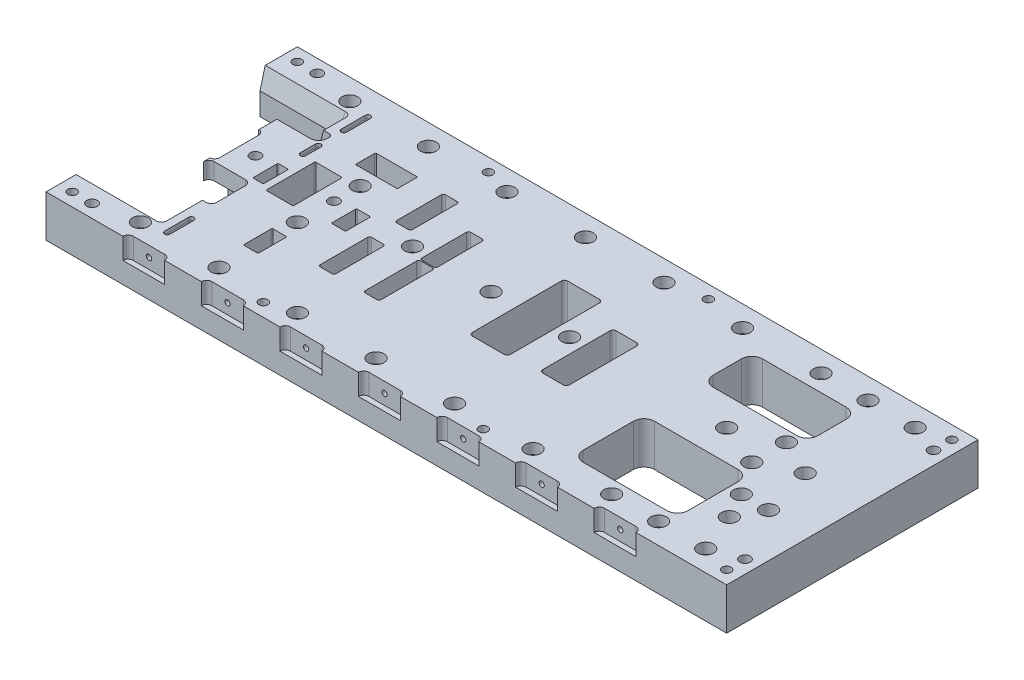
from build123d import *

# Parameters (mm, degrees)
SKETCH1_W                    = 650
SKETCH1_H                    = 240
BOSS_EXTRUDE1_DEPTH          = 40
CUT_EXTRUDE2_REACH           = 350.748
SKETCH3_R                    = 7.500000000000012
SKETCH3_R_2                  = 7.5000000000000115
SKETCH4_R                    = 9.000000000000009
SKETCH4_R_2                  = 8.999999999999984
SKETCH4_R_3                  = 8.999999999999986
CUT_EXTRUDE3_DEPTH           = 5
SKETCH11_R                   = 7.5
SKETCH11_R_2                 = 7.499999999999999
SKETCH11_R_3                 = 7.500000000000012
CUT_EXTRUDE9_DEPTH           = 643.2101968203245
SKETCH12_R                   = 10.000000000000002
CUT_EXTRUDE10_DEPTH          = 5
SKETCH13_R                   = 9.999999999999995
SKETCH13_R_2                 = 9.99999999999998
SKETCH13_R_3                 = 9.999999999999979
CUT_EXTRUDE11_DEPTH          = 30
CUT_EXTRUDE12_REACH          = 350.748
SKETCH28_R                   = 7.500000000000014
SKETCH28_R_2                 = 7.5000000000000275
SKETCH28_R_3                 = 7.499999999999957
SKETCH29_R                   = 8.99999999999998
SKETCH29_R_2                 = 9.00000000000001
SKETCH29_R_3                 = 8.999999999999986
SKETCH29_R_4                 = 8.999999999999968
SKETCH29_R_5                 = 8.999999999999925
CUT_EXTRUDE13_DEPTH          = 30
CUT_EXTRUDE14_DEPTH          = 20
LPATTERN1_COUNT              = 7
LPATTERN1_PITCH              = 75
CUT_EXTRUDE15_REACH          = 350.748
CUT_EXTRUDE16_REACH          = 350.748
CUT_EXTRUDE17_REACH          = 350.748
CUT_EXTRUDE18_REACH          = 350.748
CUT_EXTRUDE19_REACH          = 350.748
CUT_EXTRUDE20_REACH          = 350.748
CUT_EXTRUDE21_REACH          = 350.748
CUT_EXTRUDE22_REACH          = 350.748
SKETCH46_R                   = 4.999999999999989
CUT_EXTRUDE23_REACH          = 350.748
SKETCH47_R                   = 7.5000000000000115
SKETCH47_R_2                 = 7.500000000000012
SKETCH48_R                   = 9.000000000000009
CUT_EXTRUDE24_DEPTH          = 30
CUT_EXTRUDE25_REACH          = 350.748
CUT_EXTRUDE27_REACH          = 350.748
SKETCH54_W                   = 5.0999999999999375
SKETCH54_H                   = 28.000000000000256
FILLET1_R                    = 2.55
FILLET2_R                    = 2.55
FILLET3_R                    = 2.55
FILLET4_R                    = 2.55
CUT_EXTRUDE28_REACH          = 350.748
CUT_EXTRUDE29_REACH          = 350.748
CUT_EXTRUDE30_START          = -76.63
CUT_EXTRUDE30_DEPTH          = 76.63
FILLET5_R                    = 3
SKETCH63_W                   = 12.999999999999849
SKETCH63_H                   = 16.0022128562178
CUT_EXTRUDE31_DEPTH          = 50.13
CUT_EXTRUDE32_REACH          = 350.748
CHAMFER1_SIZE                = 5
CHAMFER1_SIZE2               = 18.66025403784461
FILLET6_R                    = 5
CUT_EXTRUDE34_REACH          = 350.748
FILLET7_R                    = 5
CHAMFER2_SIZE                = 5
CHAMFER2_SIZE2               = 18.66025403784461
FILLET8_R                    = 5
FILLET9_R                    = 5
FILLET10_R                   = 3
CUT_EXTRUDE35_REACH          = 350.748
CUT_EXTRUDE36_REACH          = 350.748
SKETCH67_R                   = 4.9999999999999885
M10_TAPPED_HOLE1_D           = 8.5
M10_TAPPED_HOLE1_CSINK_D     = 10.05
M10_TAPPED_HOLE1_CSINK_ANGLE = 90
F_10_0MM_DOWEL_HOLE2_D       = 10


with BuildPart() as part:
    # Sketch1 → Boss-Extrude1 (new body)
    with BuildSketch(Plane(origin=(0, 0, 0), x_dir=(1, 0, 0), z_dir=(0, 1, 0))):
        Rectangle(SKETCH1_W, SKETCH1_H)
    extrude(amount=-BOSS_EXTRUDE1_DEPTH)

    # Sketch3 → Cut-Extrude2 (cut, up to next)
    with BuildSketch(Plane(origin=(0, 0, 0), x_dir=(1, 0, 0), z_dir=(0, 1, 0)), mode=Mode.PRIVATE) as cut_extrude2_sk1:
        with Locations(Location((235.62999999999982, 26.359999999999268, 0), (0, 0, 270))):
            Circle(SKETCH3_R)
    cut_extrude2_tool1 = extrude(cut_extrude2_sk1.sketch, amount=-CUT_EXTRUDE2_REACH, mode=Mode.PRIVATE) & part.part
    # Sketch3 → Cut-Extrude2 (cut, up to next)
    with BuildSketch(Plane(origin=(0, 0, 0), x_dir=(1, 0, 0), z_dir=(0, 1, 0)), mode=Mode.PRIVATE) as cut_extrude2_sk2:
        with Locations(Location((235.63000000000017, -6.640000000000736, 0), (0, 0, 270))):
            Circle(SKETCH3_R)
    cut_extrude2_tool2 = extrude(cut_extrude2_sk2.sketch, amount=-CUT_EXTRUDE2_REACH, mode=Mode.PRIVATE) & part.part
    # Sketch3 → Cut-Extrude2 (cut, up to next)
    with BuildSketch(Plane(origin=(0, 0, 0), x_dir=(1, 0, 0), z_dir=(0, 1, 0)), mode=Mode.PRIVATE) as cut_extrude2_sk3:
        with Locations(Location((270.13000000000073, -62.640000000000406, 0), (0, 0, 270))):
            Circle(SKETCH3_R_2)
    cut_extrude2_tool3 = extrude(cut_extrude2_sk3.sketch, amount=-CUT_EXTRUDE2_REACH, mode=Mode.PRIVATE) & part.part
    # Sketch3 → Cut-Extrude2 (cut, up to next)
    with BuildSketch(Plane(origin=(0, 0, 0), x_dir=(1, 0, 0), z_dir=(0, 1, 0)), mode=Mode.PRIVATE) as cut_extrude2_sk4:
        with Locations(Location((283.13000000000045, -38.14000000000025, 0), (0, 0, 270))):
            Circle(SKETCH3_R_2)
    cut_extrude2_tool4 = extrude(cut_extrude2_sk4.sketch, amount=-CUT_EXTRUDE2_REACH, mode=Mode.PRIVATE) & part.part
    # Sketch3 → Cut-Extrude2 (cut, up to next)
    with BuildSketch(Plane(origin=(0, 0, 0), x_dir=(1, 0, 0), z_dir=(0, 1, 0)), mode=Mode.PRIVATE) as cut_extrude2_sk5:
        with Locations(Location((257.1300000000005, -38.140000000000526, 0), (0, 0, 270))):
            Circle(SKETCH3_R_2)
    cut_extrude2_tool5 = extrude(cut_extrude2_sk5.sketch, amount=-CUT_EXTRUDE2_REACH, mode=Mode.PRIVATE) & part.part
    # Sketch3 → Cut-Extrude2 (cut, up to next)
    with BuildSketch(Plane(origin=(0, 0, 0), x_dir=(1, 0, 0), z_dir=(0, 1, 0)), mode=Mode.PRIVATE) as cut_extrude2_sk6:
        with BuildLine():
            Line((155.13000000000088, 83.9999999999991), (235.13000000000085, 83.99999999999912))
            ThreePointArc((235.13000000000085, 83.99999999999912), (242.20106781186632, 81.07106781186457), (245.13000000000085, 73.99999999999909))
            Line((245.13000000000085, 73.99999999999909), (245.13000000000085, 46.999999999999105))
            ThreePointArc((245.13000000000085, 46.999999999999105), (242.20106781186635, 39.92893218813361), (235.13000000000085, 36.999999999999076))
            Line((235.13000000000085, 36.999999999999076), (155.13000000000088, 36.99999999999909))
            ThreePointArc((155.13000000000088, 36.99999999999909), (148.0589321881354, 39.928932188133615), (145.13000000000088, 46.99999999999909))
            Line((145.13000000000088, 46.99999999999909), (145.13000000000088, 73.99999999999909))
            ThreePointArc((145.13000000000088, 73.99999999999909), (148.0589321881354, 81.07106781186458), (155.13000000000088, 83.9999999999991))
        make_face()
    cut_extrude2_tool6 = extrude(cut_extrude2_sk6.sketch, amount=-CUT_EXTRUDE2_REACH, mode=Mode.PRIVATE) & part.part
    # Sketch3 → Cut-Extrude2 (cut, up to next)
    with BuildSketch(Plane(origin=(0, 0, 0), x_dir=(1, 0, 0), z_dir=(0, 1, 0)), mode=Mode.PRIVATE) as cut_extrude2_sk7:
        with BuildLine():
            Line((155.13000000000088, -19.140000000000935), (235.13000000000085, -19.140000000000935))
            ThreePointArc((235.13000000000085, -19.140000000000935), (242.20106781186632, -22.068932188135452), (245.13000000000085, -29.140000000000928))
            Line((245.13000000000085, -29.140000000000928), (245.13000000000085, -77.14000000000094))
            ThreePointArc((245.13000000000085, -77.14000000000094), (242.20106781186632, -84.21106781186641), (235.13000000000085, -87.14000000000094))
            Line((235.13000000000085, -87.14000000000094), (155.13000000000088, -87.14000000000094))
            ThreePointArc((155.13000000000088, -87.14000000000094), (148.0589321881354, -84.21106781186641), (145.13000000000088, -77.14000000000094))
            Line((145.13000000000088, -77.14000000000094), (145.13000000000088, -29.140000000000928))
            ThreePointArc((145.13000000000088, -29.140000000000928), (148.0589321881354, -22.068932188135456), (155.13000000000088, -19.140000000000935))
        make_face()
    cut_extrude2_tool7 = extrude(cut_extrude2_sk7.sketch, amount=-CUT_EXTRUDE2_REACH, mode=Mode.PRIVATE) & part.part
    add(cut_extrude2_tool1.solids().sort_by_distance((235.63, 0, -26.36))[0], mode=Mode.SUBTRACT)
    add(cut_extrude2_tool2.solids().sort_by_distance((235.63, 0, 6.64))[0], mode=Mode.SUBTRACT)
    add(cut_extrude2_tool3.solids().sort_by_distance((270.13, 0, 62.64))[0], mode=Mode.SUBTRACT)
    add(cut_extrude2_tool4.solids().sort_by_distance((283.13, 0, 38.14))[0], mode=Mode.SUBTRACT)
    add(cut_extrude2_tool5.solids().sort_by_distance((257.13, 0, 38.14))[0], mode=Mode.SUBTRACT)
    add(cut_extrude2_tool6.solids().sort_by_distance((195.13, 0, -60.5))[0], mode=Mode.SUBTRACT)
    add(cut_extrude2_tool7.solids().sort_by_distance((195.13, 0, 53.14))[0], mode=Mode.SUBTRACT)

    # Sketch4 → Cut-Extrude3 (cut)
    with BuildSketch(Plane.XZ.offset(40)):
        with Locations(Location((235.62999999999982, -26.359999999999268, 0), (0, 0, 270))):
            Circle(SKETCH4_R)
        with Locations(Location((235.63000000000017, 6.640000000000736, 0), (0, 0, 270))):
            Circle(SKETCH4_R)
        with Locations(Location((257.1300000000005, 38.140000000000526, 0), (0, 0, 270))):
            Circle(SKETCH4_R_2)
        with Locations(Location((283.13000000000045, 38.14000000000025, 0), (0, 0, 270))):
            Circle(SKETCH4_R_2)
        with Locations(Location((270.13000000000073, 62.640000000000406, 0), (0, 0, 270))):
            Circle(SKETCH4_R_3)
    extrude(amount=-CUT_EXTRUDE3_DEPTH, mode=Mode.SUBTRACT)

    # Sketch11 → Cut-Extrude9 (cut, through all)
    with BuildSketch(Plane(origin=(304.63000000000005, 3.47e-15, 0), x_dir=(1, 0, 0), z_dir=(0, 1, 0))):
        with Locations(Location((-34.500000000000064, 9.859999999999625, 0), (0, 0, 270))):
            Circle(SKETCH11_R)
        with Locations(Location((-109.50000000000006, 9.859999999998838, 0), (0, 0, 270))):
            Circle(SKETCH11_R_2)
        with Locations(Location((-259.50000000000006, 9.859999999997267, 0), (0, 0, 270))):
            Circle(SKETCH11_R_3)
        with Locations(Location((-334.5, 9.85999999999648, 0), (0, 0, 270))):
            Circle(SKETCH11_R_3)
        with Locations(Location((-409.5000000000001, 9.859999999995695, 0), (0, 0, 270))):
            Circle(SKETCH11_R_3)
    extrude(amount=-CUT_EXTRUDE9_DEPTH, mode=Mode.SUBTRACT)

    # Sketch12 → Cut-Extrude10 (cut)
    with BuildSketch(Plane(origin=(304.63000000000005, -40.00000000000001, 0), x_dir=(1, 0, 0), z_dir=(0, -1, 0))):
        with Locations(Location((-34.500000000000064, -9.859999999999625, 0), (0, 0, 270))):
            Circle(SKETCH12_R)
    extrude(amount=-CUT_EXTRUDE10_DEPTH, mode=Mode.SUBTRACT)

    # Sketch13 → Cut-Extrude11 (cut)
    with BuildSketch(Plane(origin=(304.63000000000005, -40.00000000000001, 0), x_dir=(1, 0, 0), z_dir=(0, -1, 0))):
        with Locations(Location((-109.50000000000006, -9.859999999998838, 0), (0, 0, 270))):
            Circle(SKETCH13_R)
        with Locations(Location((-334.5, -9.85999999999648, 0), (0, 0, 270))):
            Circle(SKETCH13_R_2)
        with Locations(Location((-259.50000000000006, -9.859999999997267, 0), (0, 0, 270))):
            Circle(SKETCH13_R_3)
        with Locations(Location((-409.5000000000001, -9.859999999995695, 0), (0, 0, 270))):
            Circle(SKETCH13_R_2)
    extrude(amount=-CUT_EXTRUDE11_DEPTH, mode=Mode.SUBTRACT)

    # Sketch28 → Cut-Extrude12 (cut, up to next)
    with BuildSketch(Plane(origin=(0, 0, 0), x_dir=(1, 0, 0), z_dir=(0, 1, 0)), mode=Mode.PRIVATE) as cut_extrude12_sk1:
        with Locations(Location((240.00000000000014, -100.00000000000492, 0), (0, 0, 270))):
            Circle(SKETCH28_R)
    cut_extrude12_tool1 = extrude(cut_extrude12_sk1.sketch, amount=-CUT_EXTRUDE12_REACH, mode=Mode.PRIVATE) & part.part
    # Sketch28 → Cut-Extrude12 (cut, up to next)
    with BuildSketch(Plane(origin=(0, 0, 0), x_dir=(1, 0, 0), z_dir=(0, 1, 0)), mode=Mode.PRIVATE) as cut_extrude12_sk2:
        with Locations(Location((285.0000000000001, -100.00000000000492, 0), (0, 0, 270))):
            Circle(SKETCH28_R)
    cut_extrude12_tool2 = extrude(cut_extrude12_sk2.sketch, amount=-CUT_EXTRUDE12_REACH, mode=Mode.PRIVATE) & part.part
    # Sketch28 → Cut-Extrude12 (cut, up to next)
    with BuildSketch(Plane(origin=(0, 0, 0), x_dir=(1, 0, 0), z_dir=(0, 1, 0)), mode=Mode.PRIVATE) as cut_extrude12_sk3:
        with Locations(Location((120.13000000000075, -100.00000000000492, 0), (0, 0, 270))):
            Circle(SKETCH28_R_2)
    cut_extrude12_tool3 = extrude(cut_extrude12_sk3.sketch, amount=-CUT_EXTRUDE12_REACH, mode=Mode.PRIVATE) & part.part
    # Sketch28 → Cut-Extrude12 (cut, up to next)
    with BuildSketch(Plane(origin=(0, 0, 0), x_dir=(1, 0, 0), z_dir=(0, 1, 0)), mode=Mode.PRIVATE) as cut_extrude12_sk4:
        with Locations(Location((45.130000000000756, -100.00000000000492, 0), (0, 0, 270))):
            Circle(SKETCH28_R)
    cut_extrude12_tool4 = extrude(cut_extrude12_sk4.sketch, amount=-CUT_EXTRUDE12_REACH, mode=Mode.PRIVATE) & part.part
    # Sketch28 → Cut-Extrude12 (cut, up to next)
    with BuildSketch(Plane(origin=(0, 0, 0), x_dir=(1, 0, 0), z_dir=(0, 1, 0)), mode=Mode.PRIVATE) as cut_extrude12_sk5:
        with Locations(Location((195.13000000000073, -100.00000000000492, 0), (0, 0, 270))):
            Circle(SKETCH28_R)
    cut_extrude12_tool5 = extrude(cut_extrude12_sk5.sketch, amount=-CUT_EXTRUDE12_REACH, mode=Mode.PRIVATE) & part.part
    # Sketch28 → Cut-Extrude12 (cut, up to next)
    with BuildSketch(Plane(origin=(0, 0, 0), x_dir=(1, 0, 0), z_dir=(0, 1, 0)), mode=Mode.PRIVATE) as cut_extrude12_sk6:
        with Locations(Location((-29.86999999999923, -100.00000000000492, 0), (0, 0, 270))):
            Circle(SKETCH28_R)
    cut_extrude12_tool6 = extrude(cut_extrude12_sk6.sketch, amount=-CUT_EXTRUDE12_REACH, mode=Mode.PRIVATE) & part.part
    # Sketch28 → Cut-Extrude12 (cut, up to next)
    with BuildSketch(Plane(origin=(0, 0, 0), x_dir=(1, 0, 0), z_dir=(0, 1, 0)), mode=Mode.PRIVATE) as cut_extrude12_sk7:
        with Locations(Location((-104.86999999999924, -100.00000000000492, 0), (0, 0, 270))):
            Circle(SKETCH28_R)
    cut_extrude12_tool7 = extrude(cut_extrude12_sk7.sketch, amount=-CUT_EXTRUDE12_REACH, mode=Mode.PRIVATE) & part.part
    # Sketch28 → Cut-Extrude12 (cut, up to next)
    with BuildSketch(Plane(origin=(0, 0, 0), x_dir=(1, 0, 0), z_dir=(0, 1, 0)), mode=Mode.PRIVATE) as cut_extrude12_sk8:
        with Locations(Location((-179.86999999999927, -100.00000000000492, 0), (0, 0, 270))):
            Circle(SKETCH28_R)
    cut_extrude12_tool8 = extrude(cut_extrude12_sk8.sketch, amount=-CUT_EXTRUDE12_REACH, mode=Mode.PRIVATE) & part.part
    # Sketch28 → Cut-Extrude12 (cut, up to next)
    with BuildSketch(Plane(origin=(0, 0, 0), x_dir=(1, 0, 0), z_dir=(0, 1, 0)), mode=Mode.PRIVATE) as cut_extrude12_sk9:
        with Locations(Location((-254.8699999999992, -100.00000000000492, 0), (0, 0, 270))):
            Circle(SKETCH28_R_3)
    cut_extrude12_tool9 = extrude(cut_extrude12_sk9.sketch, amount=-CUT_EXTRUDE12_REACH, mode=Mode.PRIVATE) & part.part
    cut_extrude12_1 = cut_extrude12_tool1.solids().sort_by_distance((240, 0, 100))[0]
    add(cut_extrude12_1, mode=Mode.SUBTRACT)
    cut_extrude12_2 = cut_extrude12_tool2.solids().sort_by_distance((285, 0, 100))[0]
    add(cut_extrude12_2, mode=Mode.SUBTRACT)
    cut_extrude12_3 = cut_extrude12_tool3.solids().sort_by_distance((120.13, 0, 100))[0]
    add(cut_extrude12_3, mode=Mode.SUBTRACT)
    cut_extrude12_4 = cut_extrude12_tool4.solids().sort_by_distance((45.13, 0, 100))[0]
    add(cut_extrude12_4, mode=Mode.SUBTRACT)
    cut_extrude12_5 = cut_extrude12_tool5.solids().sort_by_distance((195.13, 0, 100))[0]
    add(cut_extrude12_5, mode=Mode.SUBTRACT)
    cut_extrude12_6 = cut_extrude12_tool6.solids().sort_by_distance((-29.87, 0, 100))[0]
    add(cut_extrude12_6, mode=Mode.SUBTRACT)
    cut_extrude12_7 = cut_extrude12_tool7.solids().sort_by_distance((-104.87, 0, 100))[0]
    add(cut_extrude12_7, mode=Mode.SUBTRACT)
    cut_extrude12_8 = cut_extrude12_tool8.solids().sort_by_distance((-179.87, 0, 100))[0]
    add(cut_extrude12_8, mode=Mode.SUBTRACT)
    cut_extrude12_9 = cut_extrude12_tool9.solids().sort_by_distance((-254.87, 0, 100))[0]
    add(cut_extrude12_9, mode=Mode.SUBTRACT)
    cut_extrude12 = cut_extrude12_1 + cut_extrude12_2 + cut_extrude12_3 + cut_extrude12_4 + cut_extrude12_5 + cut_extrude12_6 + cut_extrude12_7 + cut_extrude12_8 + cut_extrude12_9  # Cut-Extrude12 as one shape, for the pattern or mirror that repeats it

    # Mirror1: Cut-Extrude12 across plane
    add(cut_extrude12.mirror(Plane.XY), mode=Mode.SUBTRACT)

    # Sketch29 → Cut-Extrude13 (cut)
    with BuildSketch(Plane.XZ.offset(40)):
        with Locations(Location((195.13000000000073, 100.00000000000492, 0), (0, 0, 270))):
            Circle(SKETCH29_R)
        with Locations(Location((240.00000000000014, 100.00000000000492, 0), (0, 0, 270))):
            Circle(SKETCH29_R_2)
        with Locations(Location((240.00000000000014, -100.00000000000492, 0), (0, 0, 270))):
            Circle(SKETCH29_R_2)
        with Locations(Location((195.13000000000073, -100.00000000000492, 0), (0, 0, 270))):
            Circle(SKETCH29_R)
        with Locations(Location((285.0000000000001, 100.00000000000492, 0), (0, 0, 270))):
            Circle(SKETCH29_R_3)
        with Locations(Location((285.0000000000001, -100.00000000000492, 0), (0, 0, 270))):
            Circle(SKETCH29_R_3)
        with Locations(Location((120.13000000000075, 100.00000000000439, 0), (0, 0, 270))):
            Circle(SKETCH29_R_4)
        with Locations(Location((120.13000000000075, -100.00000000000544, 0), (0, 0, 270))):
            Circle(SKETCH29_R_4)
        with Locations(Location((45.130000000000756, 100.00000000000388, 0), (0, 0, 270))):
            Circle(SKETCH29_R)
        with Locations(Location((45.130000000000756, -100.00000000000595, 0), (0, 0, 270))):
            Circle(SKETCH29_R)
        with Locations(Location((-29.86999999999923, 100.00000000000335, 0), (0, 0, 270))):
            Circle(SKETCH29_R)
        with Locations(Location((-29.86999999999923, -100.00000000000648, 0), (0, 0, 270))):
            Circle(SKETCH29_R)
        with Locations(Location((-104.86999999999924, 100.00000000000283, 0), (0, 0, 270))):
            Circle(SKETCH29_R)
        with Locations(Location((-104.86999999999924, -100.00000000000702, 0), (0, 0, 270))):
            Circle(SKETCH29_R)
        with Locations(Location((-179.86999999999927, 100.0000000000023, 0), (0, 0, 270))):
            Circle(SKETCH29_R)
        with Locations(Location((-179.86999999999927, -100.00000000000755, 0), (0, 0, 270))):
            Circle(SKETCH29_R)
        with Locations(Location((-254.8699999999992, 100.00000000000178, 0), (0, 0, 270))):
            Circle(SKETCH29_R_5)
        with Locations(Location((-254.8699999999992, -100.00000000000806, 0), (0, 0, 270))):
            Circle(SKETCH29_R_5)
    extrude(amount=-CUT_EXTRUDE13_DEPTH, mode=Mode.SUBTRACT)

    # Sketch30 → Cut-Extrude14 (cut)
    with BuildSketch(Plane(origin=(304.63000000000005, 3.47e-15, 0), x_dir=(1, 0, 0), z_dir=(0, 1, 0))):
        with BuildLine():
            Line((-106.25000000000101, -120.00000000000003), (-66.25000000000101, -120.00000000000003))
            ThreePointArc((-66.25000000000101, -120.00000000000003), (-67.71446609406827, -116.46446609406729), (-71.25000000000101, -115.00000000000001))
            Line((-71.25000000000101, -115.00000000000001), (-101.2500000000055, -115.00000000000001))
            ThreePointArc((-101.2500000000055, -115.00000000000001), (-104.78553390593534, -116.46446609406888), (-106.25000000000101, -120.00000000000003))
        make_face()
    cut_extrude14 = extrude(amount=-CUT_EXTRUDE14_DEPTH, mode=Mode.SUBTRACT)

    # Sketch32 → M6 Tapped Hole1 (revolve, cut)
    with BuildSketch(Plane(origin=(218.3799999999968, -9.999999999999996, 115.00000000000001), x_dir=(0, -1, 0), z_dir=(1, 0, 0))):
        Polygon((0, 0), (-2.82e-15, 11.502151547568898), (2.499999999999998, 9.999999999999998), (2.4999999999999902, -1.25e-15), align=None)
    m6_tapped_hole1 = revolve(axis=Axis((218.3799999999968, -9.999999999999996, 121.35000000000001), (0, 0, -1)), mode=Mode.SUBTRACT)

    # LPattern1: Cut-Extrude14, M6 Tapped Hole1 ×7
    with Locations(*[(-i * LPATTERN1_PITCH, 0, 0) for i in range(1, LPATTERN1_COUNT)]):
        add(cut_extrude14, mode=Mode.SUBTRACT)
        add(m6_tapped_hole1, mode=Mode.SUBTRACT)

    # Sketch38 → Cut-Extrude15 (cut, up to next)
    with BuildSketch(Plane(origin=(0, 0, 0), x_dir=(1, 0, 0), z_dir=(0, 1, 0)), mode=Mode.PRIVATE) as cut_extrude15_sk1:
        with BuildLine():
            Line((62.130000000000194, -32.64000000000253), (81.50000000000023, -32.64000000000253))
            ThreePointArc((81.50000000000023, -32.64000000000253), (83.62132034355987, -31.761320343562172), (84.50000000000023, -29.64000000000253))
            Line((84.50000000000023, -29.64000000000253), (84.50000000000023, 34.359999999997584))
            ThreePointArc((84.50000000000023, 34.359999999997584), (83.62132034355987, 36.48132034355723), (81.50000000000023, 37.35999999999759))
            Line((81.50000000000023, 37.35999999999759), (62.130000000000194, 37.359999999997605))
            ThreePointArc((62.130000000000194, 37.359999999997605), (60.00867965644055, 36.48132034355724), (59.13000000000019, 34.3599999999976))
            Line((59.13000000000019, 34.3599999999976), (59.13000000000019, -29.64000000000253))
            ThreePointArc((59.13000000000019, -29.64000000000253), (60.00867965644055, -31.761320343562172), (62.130000000000194, -32.64000000000253))
        make_face()
    cut_extrude15_tool1 = extrude(cut_extrude15_sk1.sketch, amount=-CUT_EXTRUDE15_REACH, mode=Mode.PRIVATE) & part.part
    add(cut_extrude15_tool1.solids().sort_by_distance((71.815, 0, -2.36))[0], mode=Mode.SUBTRACT)

    # Sketch39 → Cut-Extrude16 (cut, up to next)
    with BuildSketch(Plane(origin=(0, 0, 0), x_dir=(1, 0, 0), z_dir=(0, 1, 0)), mode=Mode.PRIVATE) as cut_extrude16_sk1:
        with BuildLine():
            Line((-2.250000000000037, -35.64000000000317), (28.130000000000265, -35.64000000000317))
            ThreePointArc((28.130000000000265, -35.64000000000317), (30.251320343559907, -34.761320343562815), (31.130000000000265, -32.64000000000317))
            Line((31.130000000000265, -32.64000000000317), (31.130000000000265, 52.35999999999707))
            ThreePointArc((31.130000000000265, 52.35999999999707), (30.251320343559915, 54.48132034355672), (28.130000000000265, 55.35999999999708))
            Line((28.130000000000265, 55.35999999999708), (-2.250000000000037, 55.35999999999708))
            ThreePointArc((-2.250000000000037, 55.35999999999708), (-4.371320343559679, 54.48132034355672), (-5.250000000000037, 52.35999999999707))
            Line((-5.250000000000037, 52.35999999999707), (-5.250000000000037, -32.64000000000317))
            ThreePointArc((-5.250000000000037, -32.64000000000317), (-4.371320343559679, -34.761320343562815), (-2.250000000000037, -35.64000000000317))
        make_face()
    cut_extrude16_tool1 = extrude(cut_extrude16_sk1.sketch, amount=-CUT_EXTRUDE16_REACH, mode=Mode.PRIVATE) & part.part
    add(cut_extrude16_tool1.solids().sort_by_distance((12.94, 0, -9.86))[0], mode=Mode.SUBTRACT)

    # Sketch40 → Cut-Extrude17 (cut, up to next)
    with BuildSketch(Plane(origin=(0, 0, 0), x_dir=(1, 0, 0), z_dir=(0, 1, 0)), mode=Mode.PRIVATE) as cut_extrude17_sk1:
        with BuildLine():
            Line((-88.86999999999937, -51.14000000000426), (-77.86999999999935, -51.14000000000426))
            ThreePointArc((-77.86999999999935, -51.14000000000426), (-76.45578643762624, -50.55421356237735), (-75.86999999999935, -49.14000000000425))
            Line((-75.86999999999935, -49.14000000000425), (-75.86999999999935, -0.14000000000390783))
            ThreePointArc((-75.86999999999935, -0.14000000000390783), (-76.45578643762624, 1.274213562369193), (-77.86999999999935, 1.8599999999961008))
            Line((-77.86999999999935, 1.8599999999961008), (-88.86999999999937, 1.8599999999961008))
            ThreePointArc((-88.86999999999937, 1.8599999999961008), (-90.28421356237246, 1.2742135623691873), (-90.86999999999937, -0.14000000000390783))
            Line((-90.86999999999937, -0.14000000000390783), (-90.86999999999937, -49.14000000000425))
            ThreePointArc((-90.86999999999937, -49.14000000000425), (-90.28421356237247, -50.55421356237735), (-88.86999999999937, -51.14000000000426))
        make_face()
    cut_extrude17_tool1 = extrude(cut_extrude17_sk1.sketch, amount=-CUT_EXTRUDE17_REACH, mode=Mode.PRIVATE) & part.part
    # Sketch40 → Cut-Extrude17 (cut, up to next)
    with BuildSketch(Plane(origin=(0, 0, 0), x_dir=(1, 0, 0), z_dir=(0, 1, 0)), mode=Mode.PRIVATE) as cut_extrude17_sk2:
        with BuildLine():
            Line((-131.86999999999975, -51.14000000000459), (-120.86999999999973, -51.14000000000459))
            ThreePointArc((-120.86999999999973, -51.14000000000459), (-119.45578643762664, -50.55421356237768), (-118.86999999999959, -49.14000000000459))
            Line((-118.86999999999959, -49.14000000000459), (-118.86999999999959, -4.140000000004466))
            ThreePointArc((-118.86999999999959, -4.140000000004466), (-119.45578643762664, -2.72578643763137), (-120.86999999999973, -2.1400000000044646))
            Line((-120.86999999999973, -2.1400000000044646), (-131.86999999999975, -2.1400000000044646))
            ThreePointArc((-131.86999999999975, -2.1400000000044646), (-133.28421356237294, -2.7257864376312706), (-133.8699999999999, -4.140000000004466))
            Line((-133.8699999999999, -4.140000000004466), (-133.8699999999999, -49.14000000000459))
            ThreePointArc((-133.8699999999999, -49.14000000000459), (-133.28421356237286, -50.55421356237768), (-131.86999999999975, -51.14000000000459))
        make_face()
    cut_extrude17_tool2 = extrude(cut_extrude17_sk2.sketch, amount=-CUT_EXTRUDE17_REACH, mode=Mode.PRIVATE) & part.part
    # Sketch40 → Cut-Extrude17 (cut, up to next)
    with BuildSketch(Plane(origin=(0, 0, 0), x_dir=(1, 0, 0), z_dir=(0, 1, 0)), mode=Mode.PRIVATE) as cut_extrude17_sk3:
        with BuildLine():
            Line((-88.87000000000033, 2.8599999999962025), (-77.87000000000033, 2.8599999999962025))
            ThreePointArc((-77.87000000000033, 2.8599999999962025), (-76.45578643762724, 3.4457864376231075), (-75.87000000000033, 4.8599999999962025))
            Line((-75.87000000000033, 4.8599999999962025), (-75.87000000000033, 47.35999999999563))
            ThreePointArc((-75.87000000000033, 47.35999999999563), (-76.45578643762724, 48.77421356236872), (-77.87000000000033, 49.35999999999563))
            Line((-77.87000000000033, 49.35999999999563), (-88.87000000000033, 49.35999999999563))
            ThreePointArc((-88.87000000000033, 49.35999999999563), (-90.28421356237344, 48.774213562368736), (-90.87000000000035, 47.35999999999563))
            Line((-90.87000000000035, 47.35999999999563), (-90.87000000000035, 4.8599999999962025))
            ThreePointArc((-90.87000000000035, 4.8599999999962025), (-90.28421356237342, 3.4457864376231075), (-88.87000000000033, 2.8599999999962025))
        make_face()
    cut_extrude17_tool3 = extrude(cut_extrude17_sk3.sketch, amount=-CUT_EXTRUDE17_REACH, mode=Mode.PRIVATE) & part.part
    # Sketch40 → Cut-Extrude17 (cut, up to next)
    with BuildSketch(Plane(origin=(0, 0, 0), x_dir=(1, 0, 0), z_dir=(0, 1, 0)), mode=Mode.PRIVATE) as cut_extrude17_sk4:
        with BuildLine():
            Line((-131.86999999999975, 21.859999999995473), (-120.86999999999973, 21.859999999995473))
            ThreePointArc((-120.86999999999973, 21.859999999995473), (-119.45578643762664, 22.44578643762238), (-118.86999999999972, 23.859999999995477))
            Line((-118.86999999999972, 23.859999999995477), (-118.86999999999972, 66.35999999999554))
            ThreePointArc((-118.86999999999972, 66.35999999999554), (-119.45578643762664, 67.77421356236863), (-120.86999999999973, 68.35999999999554))
            Line((-120.86999999999973, 68.35999999999554), (-131.86999999999975, 68.35999999999554))
            ThreePointArc((-131.86999999999975, 68.35999999999554), (-133.28421356237286, 67.77421356236863), (-133.86999999999975, 66.35999999999554))
            Line((-133.86999999999975, 66.35999999999554), (-133.86999999999975, 23.859999999995477))
            ThreePointArc((-133.86999999999975, 23.859999999995477), (-133.28421356237286, 22.44578643762238), (-131.86999999999975, 21.859999999995473))
        make_face()
    cut_extrude17_tool4 = extrude(cut_extrude17_sk4.sketch, amount=-CUT_EXTRUDE17_REACH, mode=Mode.PRIVATE) & part.part
    add(cut_extrude17_tool1.solids().sort_by_distance((-83.37, 0, 24.64))[0], mode=Mode.SUBTRACT)
    add(cut_extrude17_tool2.solids().sort_by_distance((-126.37, 0, 26.64))[0], mode=Mode.SUBTRACT)
    add(cut_extrude17_tool3.solids().sort_by_distance((-83.37, 0, -26.11))[0], mode=Mode.SUBTRACT)
    add(cut_extrude17_tool4.solids().sort_by_distance((-126.37, 0, -45.11))[0], mode=Mode.SUBTRACT)

    # Sketch42 → Cut-Extrude18 (cut, up to next)
    with BuildSketch(Plane(origin=(0, 0, 0), x_dir=(1, 0, 0), z_dir=(0, 1, 0)), mode=Mode.PRIVATE) as cut_extrude18_sk1:
        with BuildLine():
            Line((-150.36999999999983, -9.640000000004857), (-161.86999999999983, -9.640000000004857))
            ThreePointArc((-161.86999999999983, -9.640000000004857), (-162.5771067811864, -9.347106781191405), (-162.86999999999983, -8.640000000004857))
            Line((-162.86999999999983, -8.640000000004857), (-162.86999999999983, 13.359999999995196))
            ThreePointArc((-162.86999999999983, 13.359999999995196), (-162.5771067811864, 14.067106781181746), (-161.86999999999983, 14.3599999999952))
            Line((-161.86999999999983, 14.3599999999952), (-150.36999999999983, 14.3599999999952))
            ThreePointArc((-150.36999999999983, 14.3599999999952), (-149.66289321881328, 14.067106781181742), (-149.36999999999983, 13.35999999999519))
            Line((-149.36999999999983, 13.35999999999519), (-149.36999999999983, -8.640000000004848))
            ThreePointArc((-149.36999999999983, -8.640000000004848), (-149.66289321881328, -9.347106781191401), (-150.36999999999983, -9.640000000004857))
        make_face()
    cut_extrude18_tool1 = extrude(cut_extrude18_sk1.sketch, amount=-CUT_EXTRUDE18_REACH, mode=Mode.PRIVATE) & part.part
    add(cut_extrude18_tool1.solids().sort_by_distance((-156.12, 0, -2.36))[0], mode=Mode.SUBTRACT)

    # Sketch43 → Cut-Extrude19 (cut, up to next)
    with BuildSketch(Plane(origin=(0, 0, 0), x_dir=(1, 0, 0), z_dir=(0, 1, 0)), mode=Mode.PRIVATE) as cut_extrude19_sk1:
        with BuildLine():
            Line((-185.86999999999938, -69.64000000000438), (-173.86999999999918, -69.64000000000438))
            ThreePointArc((-173.86999999999918, -69.64000000000438), (-173.16289321881266, -69.34710678119093), (-172.86999999999918, -68.64000000000439))
            Line((-172.86999999999918, -68.64000000000439), (-172.86999999999918, -43.14000000000515))
            ThreePointArc((-172.86999999999918, -43.14000000000515), (-173.16289321881263, -42.4328932188186), (-173.86999999999918, -42.140000000005145))
            Line((-173.86999999999918, -42.140000000005145), (-185.86999999999938, -42.140000000005145))
            ThreePointArc((-185.86999999999938, -42.140000000005145), (-186.57710678118593, -42.432893218818606), (-186.86999999999938, -43.14000000000515))
            Line((-186.86999999999938, -43.14000000000515), (-186.86999999999938, -68.64000000000439))
            ThreePointArc((-186.86999999999938, -68.64000000000439), (-186.5771067811859, -69.34710678119093), (-185.86999999999938, -69.64000000000438))
        make_face()
    cut_extrude19_tool1 = extrude(cut_extrude19_sk1.sketch, amount=-CUT_EXTRUDE19_REACH, mode=Mode.PRIVATE) & part.part
    add(cut_extrude19_tool1.solids().sort_by_distance((-179.87, 0, 55.89))[0], mode=Mode.SUBTRACT)

    # Sketch44 → Cut-Extrude20 (cut, up to next)
    with BuildSketch(Plane(origin=(0, 0, 0), x_dir=(1, 0, 0), z_dir=(0, 1, 0)), mode=Mode.PRIVATE) as cut_extrude20_sk1:
        with BuildLine():
            Line((-220.37000000000006, -13.640000000005443), (-196.37000000000015, -13.640000000005447))
            ThreePointArc((-196.37000000000015, -13.640000000005447), (-195.6628932188136, -13.347106781191993), (-195.37000000000015, -12.640000000005445))
            Line((-195.37000000000015, -12.640000000005445), (-195.37000000000015, 32.35999999999469))
            ThreePointArc((-195.37000000000015, 32.35999999999469), (-195.6628932188136, 33.06710678118123), (-196.37000000000015, 33.359999999994685))
            Line((-196.37000000000015, 33.359999999994685), (-220.37000000000006, 33.3599999999947))
            ThreePointArc((-220.37000000000006, 33.3599999999947), (-221.07710678118661, 33.067106781181245), (-221.37000000000006, 32.35999999999469))
            Line((-221.37000000000006, 32.35999999999469), (-221.37000000000006, -12.640000000005434))
            ThreePointArc((-221.37000000000006, -12.640000000005434), (-221.07710678118661, -13.347106781191988), (-220.37000000000006, -13.640000000005443))
        make_face()
    cut_extrude20_tool1 = extrude(cut_extrude20_sk1.sketch, amount=-CUT_EXTRUDE20_REACH, mode=Mode.PRIVATE) & part.part
    add(cut_extrude20_tool1.solids().sort_by_distance((-208.37, 0, -9.86))[0], mode=Mode.SUBTRACT)

    # Sketch45 → Cut-Extrude21 (cut, up to next)
    with BuildSketch(Plane(origin=(0, 0, 0), x_dir=(1, 0, 0), z_dir=(0, 1, 0)), mode=Mode.PRIVATE) as cut_extrude21_sk1:
        with BuildLine():
            Line((-198.87000000000054, 50.35999999999473), (-160.86999999999972, 50.35999999999473))
            ThreePointArc((-160.86999999999972, 50.35999999999473), (-160.16289321881317, 50.65289321880818), (-159.86999999999972, 51.35999999999472))
            Line((-159.86999999999972, 51.35999999999472), (-159.86999999999972, 68.63999999999513))
            ThreePointArc((-159.86999999999972, 68.63999999999513), (-160.16289321881317, 69.34710678118168), (-160.86999999999972, 69.63999999999513))
            Line((-160.86999999999972, 69.63999999999513), (-198.87000000000054, 69.63999999999513))
            ThreePointArc((-198.87000000000054, 69.63999999999513), (-199.5771067811871, 69.34710678118168), (-199.87000000000054, 68.63999999999513))
            Line((-199.87000000000054, 68.63999999999513), (-199.87000000000054, 51.35999999999472))
            ThreePointArc((-199.87000000000054, 51.35999999999472), (-199.5771067811871, 50.652893218808174), (-198.87000000000054, 50.35999999999473))
        make_face()
    cut_extrude21_tool1 = extrude(cut_extrude21_sk1.sketch, amount=-CUT_EXTRUDE21_REACH, mode=Mode.PRIVATE) & part.part
    add(cut_extrude21_tool1.solids().sort_by_distance((-179.87, 0, -60))[0], mode=Mode.SUBTRACT)

    # Sketch46 → Cut-Extrude22 (cut, up to next)
    with BuildSketch(Plane(origin=(0, 0, 0), x_dir=(1, 0, 0), z_dir=(0, 1, 0)), mode=Mode.PRIVATE) as cut_extrude22_sk1:
        with Locations(Location((-179.86999999999998, 9.85999999999491, 0), (0, 0, 270))):
            Circle(SKETCH46_R)
    cut_extrude22_tool1 = extrude(cut_extrude22_sk1.sketch, amount=-CUT_EXTRUDE22_REACH, mode=Mode.PRIVATE) & part.part
    add(cut_extrude22_tool1.solids().sort_by_distance((-179.87, 0, -9.86))[0], mode=Mode.SUBTRACT)

    # Sketch47 → Cut-Extrude23 (cut, up to next)
    with BuildSketch(Plane(origin=(0, 0, 0), x_dir=(1, 0, 0), z_dir=(0, 1, 0)), mode=Mode.PRIVATE) as cut_extrude23_sk1:
        with Locations(Location((-179.8700000000005, 34.85999999999491, 0), (0, 0, 270))):
            Circle(SKETCH47_R)
    cut_extrude23_tool1 = extrude(cut_extrude23_sk1.sketch, amount=-CUT_EXTRUDE23_REACH, mode=Mode.PRIVATE) & part.part
    # Sketch47 → Cut-Extrude23 (cut, up to next)
    with BuildSketch(Plane(origin=(0, 0, 0), x_dir=(1, 0, 0), z_dir=(0, 1, 0)), mode=Mode.PRIVATE) as cut_extrude23_sk2:
        with Locations(Location((-179.8700000000005, -25.140000000005095, 0), (0, 0, 270))):
            Circle(SKETCH47_R_2)
    cut_extrude23_tool2 = extrude(cut_extrude23_sk2.sketch, amount=-CUT_EXTRUDE23_REACH, mode=Mode.PRIVATE) & part.part
    add(cut_extrude23_tool1.solids().sort_by_distance((-179.87, 0, -34.86))[0], mode=Mode.SUBTRACT)
    add(cut_extrude23_tool2.solids().sort_by_distance((-179.87, 0, 25.14))[0], mode=Mode.SUBTRACT)

    # Sketch48 → Cut-Extrude24 (cut)
    with BuildSketch(Plane.XZ.offset(40)):
        with Locations(Location((-179.8700000000005, 25.140000000005095, 0), (0, 0, 270))):
            Circle(SKETCH48_R)
        with Locations(Location((-179.8700000000005, -34.85999999999491, 0), (0, 0, 270))):
            Circle(SKETCH48_R)
    extrude(amount=-CUT_EXTRUDE24_DEPTH, mode=Mode.SUBTRACT)

    # Sketch49 → Cut-Extrude25 (cut, up to next)
    with BuildSketch(Plane(origin=(0, 0, 0), x_dir=(1, 0, 0), z_dir=(0, 1, 0)), mode=Mode.PRIVATE) as cut_extrude25_sk1:
        with BuildLine():
            Line((-235.92000000000024, 33.85999999999432), (-235.92000000000024, 48.35999999999432))
            ThreePointArc((-235.92000000000024, 48.35999999999432), (-233.3700000000003, 50.90999999999425), (-230.82000000000036, 48.35999999999432))
            Line((-230.82000000000036, 48.35999999999432), (-230.82000000000036, 33.85999999999432))
            ThreePointArc((-230.82000000000036, 33.85999999999432), (-233.3700000000003, 31.309999999994368), (-235.92000000000024, 33.85999999999432))
        make_face()
    cut_extrude25_tool1 = extrude(cut_extrude25_sk1.sketch, amount=-CUT_EXTRUDE25_REACH, mode=Mode.PRIVATE) & part.part
    add(cut_extrude25_tool1.solids().sort_by_distance((-233.37, 0, -41.11))[0], mode=Mode.SUBTRACT)

    # Cut-Sweep1: sweep along a path in Sketch52
    with BuildLine(Plane(origin=(0, 0, 0), x_dir=(1, 0, 0), z_dir=(0, 1, 0))) as cut_sweep1_path:
        Line((-235.92000000000024, 33.85999999999432), (-235.92000000000024, 48.35999999999432))
        ThreePointArc((-235.92000000000024, 48.35999999999432), (-233.3700000000003, 50.90999999999425), (-230.82000000000036, 48.35999999999432))
        Line((-230.82000000000036, 48.35999999999432), (-230.82000000000036, 33.85999999999432))
        ThreePointArc((-230.82000000000036, 33.85999999999432), (-233.3700000000003, 31.309999999994368), (-235.92000000000024, 33.85999999999432))
    # Sketch51 → Cut-Sweep1 (sweep, cut)
    with BuildSketch(Plane.XY.offset(-41.10999999999432)):
        Polygon((-230.82000000000036, -3.1999999999999997), (-230.17765361064218, -40), (-230.82000000000036, -40), align=None)
    sweep(path=cut_sweep1_path.line, mode=Mode.SUBTRACT)

    # Sketch54 → Cut-Extrude27 (cut, up to next)
    with BuildSketch(Plane(origin=(0, 0, 0), x_dir=(1, 0, 0), z_dir=(0, 1, 0)), mode=Mode.PRIVATE) as cut_extrude27_sk1:
        with Locations((-233.36999999999915, -84.32000000000629)):
            Rectangle(SKETCH54_W, SKETCH54_H)
    cut_extrude27_tool1 = extrude(cut_extrude27_sk1.sketch, amount=-CUT_EXTRUDE27_REACH, mode=Mode.PRIVATE) & part.part
    cut_extrude27 = cut_extrude27_tool1.solids().sort_by_distance((-233.37, 0, 84.32))[0]
    add(cut_extrude27, mode=Mode.SUBTRACT)

    # Mirror3: Cut-Extrude27 across plane
    add(cut_extrude27.mirror(Plane.XY), mode=Mode.SUBTRACT)

    # Fillet1
    fillet1_edges = [part.edges().sort_by_distance(p)[0] for p in [
        (-230.81999999999914, -20, 70.32000000000616),
        (-235.91999999999913, -20, 70.32000000000616),
    ]]
    fillet(fillet1_edges, radius=FILLET1_R - 0.0001)  # a hair under: the kernel refuses the full size

    # Fillet2
    fillet2_edges = [part.edges().sort_by_distance(p)[0] for p in [
        (-230.81999999999914, -20, 98.32000000000642),
        (-235.91999999999913, -20, 98.32000000000642),
    ]]
    fillet(fillet2_edges, radius=FILLET2_R - 0.0001)  # a hair under: the kernel refuses the full size

    # Fillet3
    fillet3_edges = [part.edges().sort_by_distance(p)[0] for p in [
        (-230.81999999999914, -20, -70.32000000000616),
        (-235.91999999999913, -20, -70.32000000000616),
    ]]
    fillet(fillet3_edges, radius=FILLET3_R - 0.0001)  # a hair under: the kernel refuses the full size

    # Fillet4
    fillet4_edges = [part.edges().sort_by_distance(p)[0] for p in [
        (-230.81999999999914, -20, -98.32000000000642),
        (-235.91999999999913, -20, -98.32000000000642),
    ]]
    fillet(fillet4_edges, radius=FILLET4_R - 0.0001)  # a hair under: the kernel refuses the full size

    # Cut-Sweep2: read off the stored shape, not the designer's step
    # Cut-Sweep2: loft between two sections, ruled curve by curve
    cut_sweep2_from = [
        Edge.make_three_point_arc((-235.92, -3.2, 72.87), (-235.173122292, -3.2, 71.066877708), (-233.37, -3.2, 70.32)),
        Edge.make_three_point_arc((-233.37, -3.2, 70.32), (-231.566877708, -3.2, 71.066877708), (-230.82, -3.2, 72.87)),
        Edge.make_three_point_arc((-230.82, -3.2, 95.77), (-231.566877708, -3.2, 97.573122292), (-233.37, -3.2, 98.32)),
        Edge.make_three_point_arc((-233.37, -3.2, 98.32), (-235.173122292, -3.2, 97.573122292), (-235.92, -3.2, 95.77)),
        Edge.make_line((-230.82, -3.2, 95.77), (-230.82, -3.2, 84.32)),
        Edge.make_line((-230.82, -3.2, 84.32), (-230.82, -3.2, 72.87)),
        Edge.make_line((-235.92, -3.2, 72.87), (-235.92, -3.2, 95.77)),
    ]
    cut_sweep2_to = [
        Edge.make_three_point_arc((-236.562346389, -40, 72.87), (-235.62732978, -40, 70.61267022), (-233.37, -40, 69.677653611)),
        Edge.make_three_point_arc((-233.37, -40, 69.677653611), (-231.11267022, -40, 70.61267022), (-230.177653611, -40, 72.87)),
        Edge.make_three_point_arc((-230.177653611, -40, 95.77), (-231.11267022, -40, 98.02732978), (-233.37, -40, 98.962346389)),
        Edge.make_three_point_arc((-233.37, -40, 98.962346389), (-235.62732978, -40, 98.02732978), (-236.562346389, -40, 95.77)),
        Edge.make_line((-230.177653611, -40, 95.77), (-230.177653611, -40, 84.32)),
        Edge.make_line((-230.177653611, -40, 84.32), (-230.177653611, -40, 72.87)),
        Edge.make_line((-236.562346389, -40, 72.87), (-236.562346389, -40, 95.77)),
    ]
    cut_sweep2 = Solid(Shell([*[Face.make_surface_from_curves(cut_sweep2_from[k], cut_sweep2_to[k]) for k in range(7)], Face(Wire(cut_sweep2_from)), Face(Wire(cut_sweep2_to))]))
    add(cut_sweep2, mode=Mode.SUBTRACT)

    # Mirror4: Cut-Sweep2 across plane
    add(cut_sweep2.mirror(Plane.XY), mode=Mode.SUBTRACT)

    # Sketch58 → Cut-Extrude28 (cut, up to next)
    with BuildSketch(Plane(origin=(0, 0, 0), x_dir=(1, 0, 0), z_dir=(0, 1, 0)), mode=Mode.PRIVATE) as cut_extrude28_sk1:
        with BuildLine():
            Line((-269.8699999999997, -52.14000000000594), (-239.86999999999946, -52.14000000000594))
            ThreePointArc((-239.86999999999946, -52.14000000000594), (-236.33446609406673, -50.67553390593868), (-234.86999999999946, -47.14000000000595))
            Line((-234.86999999999946, -47.14000000000595), (-234.86999999999946, -19.64000000000607))
            ThreePointArc((-234.86999999999946, -19.64000000000607), (-236.33446609406673, -16.10446609407333), (-239.86999999999946, -14.640000000006069))
            Line((-239.86999999999946, -14.640000000006069), (-269.8699999999997, -14.640000000006069))
            ThreePointArc((-269.8699999999997, -14.640000000006069), (-273.40553390593243, -16.10446609407333), (-274.8699999999997, -19.64000000000607))
            Line((-274.8699999999997, -19.64000000000607), (-274.8699999999997, -47.14000000000595))
            ThreePointArc((-274.8699999999997, -47.14000000000595), (-273.40553390593243, -50.67553390593868), (-269.8699999999997, -52.14000000000594))
        make_face()
    cut_extrude28_tool1 = extrude(cut_extrude28_sk1.sketch, amount=-CUT_EXTRUDE28_REACH, mode=Mode.PRIVATE) & part.part
    add(cut_extrude28_tool1.solids().sort_by_distance((-254.87, 0, 33.39))[0], mode=Mode.SUBTRACT)

    # Sketch59 → Cut-Extrude29 (cut, up to next)
    with BuildSketch(Plane(origin=(0, 0, 0), x_dir=(1, 0, 0), z_dir=(0, 1, 0)), mode=Mode.PRIVATE) as cut_extrude29_sk1:
        with BuildLine():
            Line((-324.99999999999994, -13.640000000006244), (-275.3700000000002, -13.640000000006236))
            ThreePointArc((-275.3700000000002, -13.640000000006236), (-271.8344660940674, -12.17553390593898), (-270.3700000000001, -8.640000000006198))
            Line((-270.3700000000001, -8.640000000006198), (-270.3700000000001, 28.359999999993867))
            ThreePointArc((-270.3700000000001, 28.359999999993867), (-271.8344660940674, 31.895533905926648), (-275.3700000000002, 33.3599999999939))
            Line((-275.3700000000002, 33.3599999999939), (-324.99999999999994, 33.3599999999939))
            Line((-324.99999999999994, 33.3599999999939), (-324.99999999999994, -13.640000000006244))
        make_face()
    cut_extrude29_tool1 = extrude(cut_extrude29_sk1.sketch, amount=-CUT_EXTRUDE29_REACH, mode=Mode.PRIVATE) & part.part
    add(cut_extrude29_tool1.solids().sort_by_distance((-297.794942, 0, -9.86))[0], mode=Mode.SUBTRACT)

    # Sketch60 → Cut-Extrude30 (cut)
    with BuildSketch(Plane.ZY.offset(324.99999999999994).offset(CUT_EXTRUDE30_START)):
        with BuildLine():
            Line((0.6400000000061027, -21.002212856217803), (0.6400000000061045, -40.00000000000001))
            Line((0.6400000000061045, -40.00000000000001), (26.640000000006093, -40))
            Line((26.640000000006093, -40), (26.640000000006093, -16.0022128562178))
            Line((26.640000000006093, -16.0022128562178), (5.640000000006103, -16.002212856217806))
            ThreePointArc((5.640000000006103, -16.002212856217806), (2.1044660940733686, -17.46667895028507), (0.6400000000061027, -21.002212856217803))
        make_face()
    extrude(amount=CUT_EXTRUDE30_DEPTH, mode=Mode.SUBTRACT)

    # Fillet5
    fillet5_edges = [part.edges().sort_by_distance(p)[0] for p in [
        (-248.36999999999995, -30.501106428108905, 0.6400000000061036),
        (-248.36999999999995, -17.46667895028507, 2.104466094073368),
        (-248.36999999999995, -16.002212856217806, 10.140000000006086),
    ]]
    fillet(fillet5_edges, radius=FILLET5_R)

    # Sketch63 → Cut-Extrude31 (cut)
    with BuildSketch(Plane.ZY.offset(324.99999999999994)):
        with Locations((20.140000000006168, -8.0011064281089)):
            Rectangle(SKETCH63_W, SKETCH63_H)
    extrude(amount=-CUT_EXTRUDE31_DEPTH, mode=Mode.SUBTRACT)

    # Sketch64 → Cut-Extrude32 (cut, up to next)
    with BuildSketch(Plane(origin=(0, 0, 0), x_dir=(1, 0, 0), z_dir=(0, 1, 0)), mode=Mode.PRIVATE) as cut_extrude32_sk1:
        with BuildLine():
            Line((-248.3699999999995, -52.14000000000608), (-248.3699999999995, -86.26238782521807))
            Line((-248.3699999999995, -86.26238782521807), (-324.99999999999994, -86.26238782521807))
            Line((-324.99999999999994, -86.26238782521807), (-324.99999999999994, -26.640000000006093))
            Line((-324.99999999999994, -26.640000000006093), (-274.8699999999997, -26.640000000006093))
            Line((-274.8699999999997, -26.640000000006093), (-274.8699999999997, -47.14000000000595))
            ThreePointArc((-274.8699999999997, -47.14000000000595), (-273.4055339059325, -50.675533905938686), (-269.8699999999997, -52.14000000000594))
            Line((-269.8699999999997, -52.14000000000594), (-248.3699999999995, -52.14000000000608))
        make_face()
    cut_extrude32_tool1 = extrude(cut_extrude32_sk1.sketch, amount=-CUT_EXTRUDE32_REACH, mode=Mode.PRIVATE) & part.part
    add(cut_extrude32_tool1.solids().sort_by_distance((-291.011891, 0, 59.401057))[0], mode=Mode.SUBTRACT)

    # Chamfer1
    chamfer1_edges = [part.edges().sort_by_distance(p)[0] for p in [
        (-286.6849999999997, 0, 86.26238782521807),
        (-248.3699999999995, 0, 69.20119391261207),
    ]]
    chamfer1_side = [part.faces().sort_by_distance(p)[0] for p in [
        (241.81502367528535, 3.47e-15, 111.56497632471375),
    ]]
    chamfer(chamfer1_edges, length=CHAMFER1_SIZE, length2=CHAMFER1_SIZE2, reference=chamfer1_side[0])

    # Fillet6
    fillet6_edges = [part.edges().sort_by_distance(p)[0] for p in [
        (-245.8699999999995, -9.330127018922308, 88.76238782521808),
    ]]
    fillet(fillet6_edges, radius=FILLET6_R)

    # Sketch65 → Cut-Extrude34 (cut, up to next)
    with BuildSketch(Plane(origin=(0, 0, 0), x_dir=(1, 0, 0), z_dir=(0, 1, 0)), mode=Mode.PRIVATE) as cut_extrude34_sk1:
        with BuildLine():
            Line((-324.99999999999994, 84.35999999999392), (-248.3699999999995, 84.35999999999392))
            Line((-248.3699999999995, 84.35999999999392), (-248.3699999999995, 63.475043541836165))
            Line((-248.3699999999995, 63.475043541836165), (-234.87000000000003, 63.475043541836165))
            Line((-234.87000000000003, 63.475043541836165), (-234.87000000000003, 58.35999999999394))
            ThreePointArc((-234.87000000000003, 58.35999999999394), (-237.21314575050766, 52.70314575050156), (-242.87000000000003, 50.35999999999394))
            Line((-242.87000000000003, 50.35999999999394), (-274.8699999999997, 50.35999999999393))
            Line((-274.8699999999997, 50.35999999999393), (-274.8699999999997, 33.35999999999391))
            Line((-274.8699999999997, 33.35999999999391), (-324.99999999999994, 33.35999999999391))
            Line((-324.99999999999994, 33.35999999999391), (-324.99999999999994, 84.35999999999392))
        make_face()
    cut_extrude34_tool1 = extrude(cut_extrude34_sk1.sketch, amount=-CUT_EXTRUDE34_REACH, mode=Mode.PRIVATE) & part.part
    add(cut_extrude34_tool1.solids().sort_by_distance((-287.789682, 0, -60.905535))[0], mode=Mode.SUBTRACT)

    # Fillet7
    fillet7_edges = [part.edges().sort_by_distance(p)[0] for p in [
        (-248.3699999999995, -26.726053735506916, 86.26238782521807),
    ]]
    fillet(fillet7_edges, radius=FILLET7_R)

    # Chamfer2
    chamfer2_edges = [part.edges().sort_by_distance(p)[0] for p in [
        (-248.3699999999995, 0, -73.91752177091504),
        (-286.6849999999997, 0, -84.35999999999392),
    ]]
    chamfer2_side = [part.faces().sort_by_distance(p)[0] for p in [
        (-239.8660288972913, 0, 94.76635892792628),
    ]]
    chamfer(chamfer2_edges, length=CHAMFER2_SIZE, length2=CHAMFER2_SIZE2, reference=chamfer2_side[0])

    # Fillet8
    fillet8_edges = [part.edges().sort_by_distance(p)[0] for p in [
        (-245.86999999999952, -9.330127018922301, -86.85999999999392),
    ]]
    fillet(fillet8_edges, radius=FILLET8_R)

    # Fillet9
    fillet9_edges = [part.edges().sort_by_distance(p)[0] for p in [
        (-248.3699999999995, -26.72605373550683, -84.35999999999392),
    ]]
    fillet(fillet9_edges, radius=FILLET9_R)

    # Fillet10
    fillet10_edges = [part.edges().sort_by_distance(p)[0] for p in [
        (-234.87000000000003, -20, -63.475043541836165),
    ]]
    fillet(fillet10_edges, radius=FILLET10_R)

    # Sketch66 → Cut-Extrude35 (cut, up to next)
    with BuildSketch(Plane(origin=(0, 0, 0), x_dir=(1, 0, 0), z_dir=(0, 1, 0)), mode=Mode.PRIVATE) as cut_extrude35_sk1:
        with BuildLine():
            Line((-236.86999999999992, -9.640000000005637), (-228.86999999999992, -9.640000000005637))
            ThreePointArc((-228.86999999999992, -9.640000000005637), (-228.16289321881337, -9.347106781192181), (-227.86999999999992, -8.64000000000563))
            Line((-227.86999999999992, -8.64000000000563), (-227.86999999999992, 13.359999999994411))
            ThreePointArc((-227.86999999999992, 13.359999999994411), (-228.16289321881337, 14.067106781180962), (-228.86999999999992, 14.359999999994418))
            Line((-228.86999999999992, 14.359999999994418), (-236.86999999999992, 14.359999999994418))
            ThreePointArc((-236.86999999999992, 14.359999999994418), (-237.57710678118647, 14.067106781180964), (-237.86999999999992, 13.359999999994411))
            Line((-237.86999999999992, 13.359999999994411), (-237.86999999999992, -8.64000000000563))
            ThreePointArc((-237.86999999999992, -8.64000000000563), (-237.57710678118647, -9.347106781192181), (-236.86999999999992, -9.640000000005637))
        make_face()
    cut_extrude35_tool1 = extrude(cut_extrude35_sk1.sketch, amount=-CUT_EXTRUDE35_REACH, mode=Mode.PRIVATE) & part.part
    add(cut_extrude35_tool1.solids().sort_by_distance((-232.87, 0, -2.36))[0], mode=Mode.SUBTRACT)

    # Sketch67 → Cut-Extrude36 (cut, up to next)
    with BuildSketch(Plane(origin=(0, 0, 0), x_dir=(1, 0, 0), z_dir=(0, 1, 0)), mode=Mode.PRIVATE) as cut_extrude36_sk1:
        with Locations(Location((-254.87000000000003, 9.859999999994129, 0), (0, 0, 270))):
            Circle(SKETCH67_R)
    cut_extrude36_tool1 = extrude(cut_extrude36_sk1.sketch, amount=-CUT_EXTRUDE36_REACH, mode=Mode.PRIVATE) & part.part
    add(cut_extrude36_tool1.solids().sort_by_distance((-254.87, 0, -9.86))[0], mode=Mode.SUBTRACT)

    # M10 Tapped Hole1 (through all)
    with Locations(Plane(origin=(0, -40, 0), x_dir=(-1, 0, 0), z_dir=(0, -1, 0))):
        with Locations((-312.5, 107.5), (312.5, 107.5), (312.5, -107.5), (-312.5, -107.5), (-80, 107.5), (130, 107.5), (-80, -107.5), (130, -107.5)):
            CounterSinkHole(M10_TAPPED_HOLE1_D / 2, M10_TAPPED_HOLE1_CSINK_D / 2, counter_sink_angle=M10_TAPPED_HOLE1_CSINK_ANGLE)

    # Ø10.0mm Dowel Hole2 (through all)
    with Locations(Plane(origin=(0, -40, 0), x_dir=(-1, 0, 0), z_dir=(0, -1, 0))):
        with Locations((-312.5, 90), (293.5, 107.5), (293.5, -107.5), (-312.5, -90)):
            Hole(F_10_0MM_DOWEL_HOLE2_D / 2)


solid = part.part
